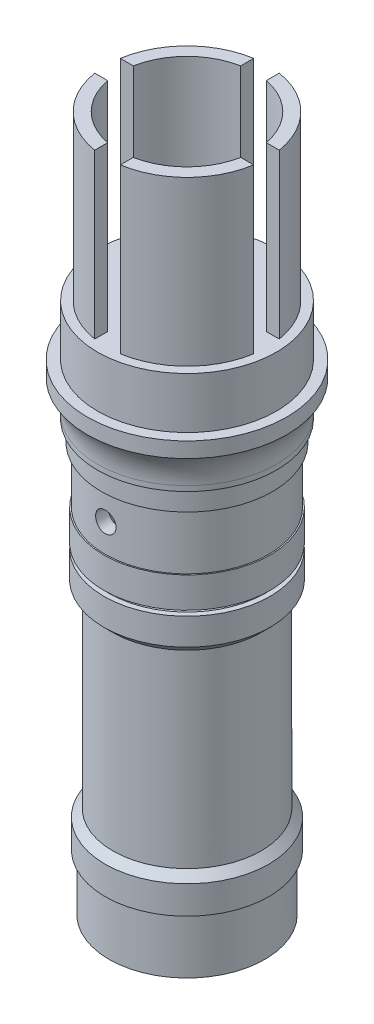
from build123d import *

# Parameters (mm, degrees)
CROQUIS2_W            = 5
CROQUIS2_H            = 39.415776956
CORTAR_EXTRUIR1_DEPTH = 22.5
MATRIZC2_COUNT        = 3
MATRIZC2_ANGLE        = 180
CROQUIS3_R            = 13.25
CORTAR_EXTRUIR2_DEPTH = 32
REDONDEO2_R           = 10
CHAFL_N1_SIZE         = 0.5
CHAFL_N2_SIZE         = 2
CROQUIS4_R            = 9
CORTAR_EXTRUIR3_DEPTH = 139.767791652
CROQUIS4_3_R          = 13.5
CROQUIS4_3_R_2        = 9
CORTAR_EXTRUIR4_DEPTH = 97


# Some blends are built 0.0001 mm under size
with BuildPart() as part:
    # Croquis1 → Revolución1 (revolve)
    with BuildSketch(Plane(origin=(0, 0, 0), x_dir=(0, 0, -1), z_dir=(1, 0, 0))):
        Polygon((0, 0), (-15.25, 0), (-15.25, 11), (-16, 11), (-16, 16), (-14.5, 16), (-14.5, 57), (-16.25, 57), (-16.25, 62), (-14.75, 62), (-14.75, 63), (-16.25, 63), (-16.25, 69), (-16, 69), (-16, 80), (-16.75, 80), (-16.75, 84), (-17.5, 84), (-17.5, 91), (-19.5, 91), (-19.5, 94), (-17.5, 94), (-17.5, 104), (-15.75, 104), (-15.75, 136), (0, 136), align=None)
    revolve(axis=Axis((0, 136, 0), (0, -1, 0)))

    # Croquis2 → Cortar-Extruir1 (cut, symmetric)
    with BuildSketch(Plane(origin=(0, 0, 0), x_dir=(0, 0, -1), z_dir=(1, 0, 0))):
        with Locations((0, 123.707888478)):
            Rectangle(CROQUIS2_W, CROQUIS2_H)
    cortar_extruir1 = extrude(amount=CORTAR_EXTRUIR1_DEPTH, both=True, mode=Mode.SUBTRACT)

    # MatrizC2: Cortar-Extruir1 ×3 about axis
    matrizc2_axis = Axis((0, 136, 0), (0, 1, 0))
    for i in range(1, MATRIZC2_COUNT):
        add(cortar_extruir1.rotate(matrizc2_axis, i * MATRIZC2_ANGLE / (MATRIZC2_COUNT - 1)), mode=Mode.SUBTRACT)

    # Croquis3 → Cortar-Extruir2 (cut)
    with BuildSketch(Plane(origin=(0, 136, 0), x_dir=(1, 0, 0), z_dir=(0, 1, 0))):
        Circle(CROQUIS3_R)
    extrude(amount=-CORTAR_EXTRUIR2_DEPTH, mode=Mode.SUBTRACT)

    # Redondeo2
    # the kernel refuses this fillet: 10 mm, written as the material it adds along each edge
    with BuildSketch(Plane(origin=(0, 91, 0), x_dir=(0, 0, 1), z_dir=(1, 0, 0))) as redondeo2_piece_1:
        with BuildLine():
            CenterArc((27.5, 6), REDONDEO2_R, 180, 36.869897646)
            Line((19.5, 0), (17.5, 0))
            Line((17.5, 0), (17.5, 6))
        make_face()
    revolve(axis=Axis((0, 91, 0), (0, -1, 0)))

    # Chaflán1
    chafl_n1_edges = [part.edges().sort_by_distance(p)[0] for p in [
        (0, 63, -14.75),
        (0, 62, -14.75),
        (0, 11, -15.25),
    ]]
    chamfer(chafl_n1_edges, length=CHAFL_N1_SIZE - 0.0001)  # a hair under: the kernel refuses the full size

    # Chaflán2
    # the kernel refuses this chamfer: 2 mm, written as the material it adds along each edge
    with BuildSketch(Plane(origin=(0, 16, 0), x_dir=(0, 0, 1), z_dir=(1, 0, 0))) as chafl_n2_piece_1_section:
        Polygon((14.5, -CHAFL_N2_SIZE), (14.5 + CHAFL_N2_SIZE, 0), (14.5, 0), align=None)
    chafl_n2_piece_1 = revolve(axis=Axis((0, 16, 0), (0, -1, 0)), mode=Mode.PRIVATE)
    chafl_n2_piece_1 = chafl_n2_piece_1 & Plane(origin=(0, 16, 0), x_dir=(0, 0, 1), z_dir=(0, 1, 0)) * Cylinder(16, 66, mode=Mode.PRIVATE)
    add(chafl_n2_piece_1)
    with BuildSketch(Plane(origin=(0, 57, 0), x_dir=(0, 0, 1), z_dir=(1, 0, 0))) as chafl_n2_piece_2_section:
        Polygon((14.5 + CHAFL_N2_SIZE, 0), (14.5, CHAFL_N2_SIZE), (14.5, 0), align=None)
    chafl_n2_piece_2 = revolve(axis=Axis((0, 57, 0), (0, -1, 0)), mode=Mode.PRIVATE)
    chafl_n2_piece_2 = chafl_n2_piece_2 & Plane(origin=(0, 57, 0), x_dir=(0, 0, 1), z_dir=(0, 1, 0)) * Cylinder(16.25, 66, mode=Mode.PRIVATE)
    add(chafl_n2_piece_2)

    # Croquis4 → Cortar-Extruir3 (cut, through all)
    with BuildSketch(Plane.XZ):
        with Locations(Location((0, 0, 0), (0, 0, 270))):
            Circle(CROQUIS4_R)
    extrude(amount=-CORTAR_EXTRUIR3_DEPTH, mode=Mode.SUBTRACT)

    # Croquis4<3> → Cortar-Extruir4 (cut)
    with BuildSketch(Plane.XZ):
        with Locations(Location((0, 0, 0), (0, 0, 270))):
            Circle(CROQUIS4_3_R)
        with Locations(Location((0, 0, 0), (0, 0, 90))):
            Circle(CROQUIS4_3_R_2, mode=Mode.SUBTRACT)
    extrude(amount=-CORTAR_EXTRUIR4_DEPTH, mode=Mode.SUBTRACT)

    # Croquis6 → Cortar-Revolución1 (revolve, cut)
    with BuildSketch(Plane(origin=(0, 0, 0), x_dir=(0, 0, -1), z_dir=(1, 0, 0)), mode=Mode.PRIVATE) as cortar_revoluci_n1_sk:
        Polygon((16, 79.5), (13.766586279, 79), (3.766586279, 79), (3.766586279, 76.5), (-16, 76.5), (-16, 74.5), (16, 74.5), align=None)
    revolve(cortar_revoluci_n1_sk.sketch.rotate(Axis((0, 74.5, 16), (0, 0, -1)), 90), axis=Axis((0, 74.5, 16), (0, 0, -1)), mode=Mode.SUBTRACT)


solid = part.part
